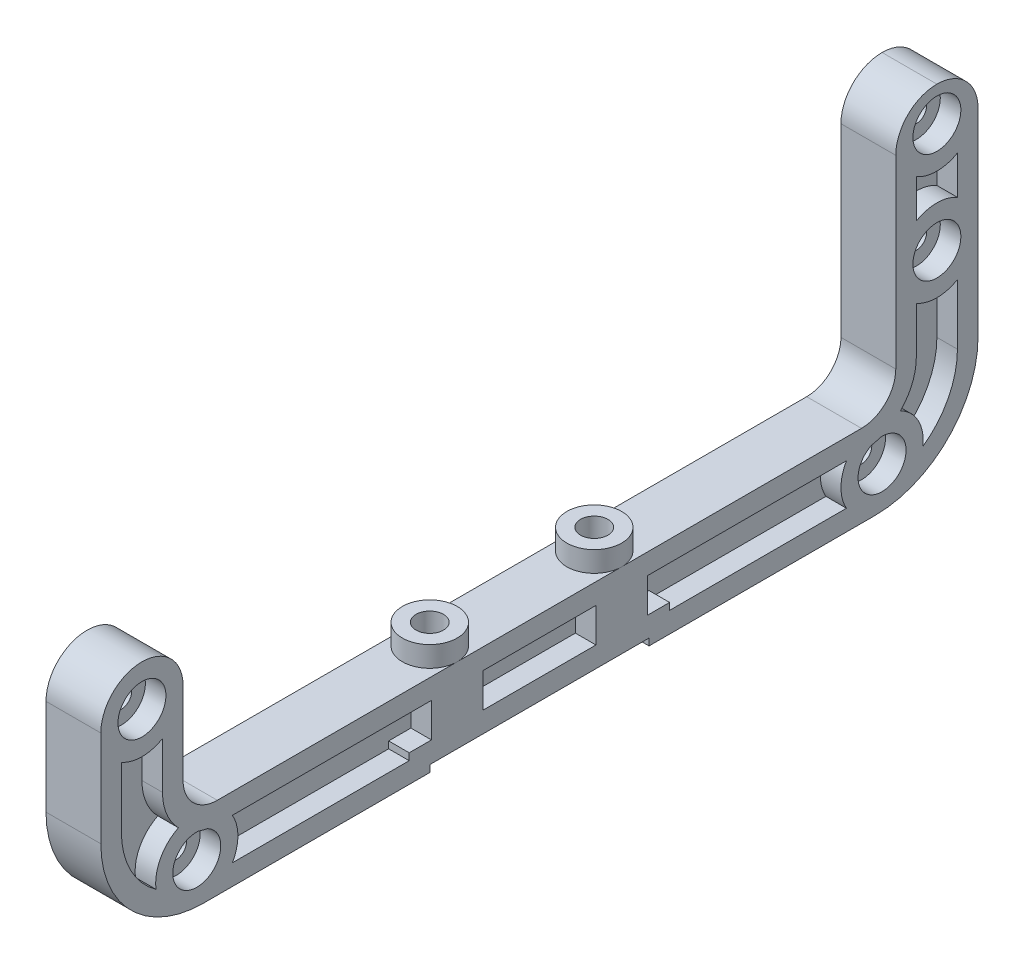
from build123d import *

# Parameters (mm, degrees)
SKETCH1_R                 = 1.5
BOSS_EXTRUDE1_DEPTH       = 8
FILLET1_R                 = 6
FILLET2_R                 = 15
FILLET3_R                 = 5
SKETCH2_R                 = 2
CUT_EXTRUDE1_DEPTH        = 97.187317251
BOSS_EXTRUDE2_START       = 3
SKETCH3_R                 = 4
SKETCH3_R_2               = 2
BOSS_EXTRUDE2_DEPTH       = 3
CUT_EXTRUDE2_START        = -3
SKETCH4_W                 = 14.5
SKETCH4_H                 = 5
SKETCH4_R                 = 1.5
SKETCH4_R_2               = 3.5
CUT_EXTRUDE2_DEPTH        = 3
MIRROR3_START             = -3
MIRROR3_COPY_1_SKETCH_W   = 14.5
MIRROR3_COPY_1_SKETCH_H   = 5
MIRROR3_COPY_1_SKETCH_R   = 1.5
MIRROR3_COPY_1_SKETCH_R_2 = 3.5
MIRROR3_COPY_1_DEPTH      = 3
MIRROR3_COPY_2_SKETCH_W   = 14.5
MIRROR3_COPY_2_SKETCH_H   = 5
MIRROR3_COPY_2_SKETCH_R   = 1.5
MIRROR3_COPY_2_SKETCH_R_2 = 3.5
MIRROR3_COPY_2_DEPTH      = 3
FILLET4_R                 = 5
FILLET5_R                 = 15
FILLET6_R                 = 6
CUT_EXTRUDE3_DEPTH        = 99.711701434


with BuildPart() as part:
    # Sketch1 → Boss-Extrude1 (new body)
    with BuildSketch(Plane(origin=(0, 0, 0), x_dir=(0, 0, -1), z_dir=(1, 0, 0))):
        Polygon((-88, -6), (-40, -6), (-40, -5), (-8, -5), (-8, -6), (40, -6), (40, 44), (28, 44), (28, 6), (-76, 6), (-76, 44), (-88, 44), align=None)
        with Locations((-74, 0)):
            Circle(SKETCH1_R, mode=Mode.SUBTRACT)
        with Locations((26, 0)):
            Circle(SKETCH1_R, mode=Mode.SUBTRACT)
        with Locations((-82, 39)):
            Circle(SKETCH1_R, mode=Mode.SUBTRACT)
        with Locations((-82, 23)):
            Circle(SKETCH1_R, mode=Mode.SUBTRACT)
        with Locations((34, 39)):
            Circle(SKETCH1_R, mode=Mode.SUBTRACT)
        with Locations((34, 23)):
            Circle(SKETCH1_R, mode=Mode.SUBTRACT)
    extrude(amount=BOSS_EXTRUDE1_DEPTH)

    # Fillet1
    fillet1_edges = [part.edges().sort_by_distance(p)[0] for p in [
        (4, 44, -28),
        (4, 44, -40),
    ]]
    fillet(fillet1_edges, radius=FILLET1_R - 0.0001)  # a hair under: the kernel refuses the full size

    # Fillet2
    fillet2_edges = [part.edges().sort_by_distance(p)[0] for p in [
        (4, -6, -40),
    ]]
    fillet(fillet2_edges, radius=FILLET2_R)

    # Fillet3
    fillet3_edges = [part.edges().sort_by_distance(p)[0] for p in [
        (4, 6, -28),
    ]]
    fillet(fillet3_edges, radius=FILLET3_R)

    # Sketch2 → Cut-Extrude1 (cut, through all)
    with BuildSketch(Plane(origin=(0, 6, 0), x_dir=(1, 0, 0), z_dir=(0, 1, 0))):
        with Locations(Location((4, -36, 0), (0, 0, 270))):
            Circle(SKETCH2_R)
        with Locations(Location((4, -12, 0), (0, 0, 270))):
            Circle(SKETCH2_R)
    extrude(amount=-CUT_EXTRUDE1_DEPTH, mode=Mode.SUBTRACT)

    # Sketch3 → Boss-Extrude2 (add)
    # profile 1 of 2: a face of its own
    with BuildSketch(Plane(origin=(0, 6, 0), x_dir=(1, 0, 0), z_dir=(0, 1, 0)).offset(BOSS_EXTRUDE2_START)):
        with Locations(Location((4, -12, 0), (0, 0, 180))):
            Circle(SKETCH3_R)
        with Locations(Location((4, -12, 0), (0, 0, 270))):
            Circle(SKETCH3_R_2, mode=Mode.SUBTRACT)
    # profile 2 of 2: a face of its own
    with BuildSketch(Plane(origin=(0, 6, 0), x_dir=(1, 0, 0), z_dir=(0, 1, 0)).offset(BOSS_EXTRUDE2_START)):
        with Locations(Location((4, -36, 0), (0, 0, 180))):
            Circle(SKETCH3_R)
        with Locations(Location((4, -36, 0), (0, 0, 270))):
            Circle(SKETCH3_R_2, mode=Mode.SUBTRACT)
    extrude(amount=-BOSS_EXTRUDE2_DEPTH)

    # Sketch4 → Cut-Extrude2 (cut)
    # profile 1 of 7: a face of its own
    with BuildSketch(Plane(origin=(8, 0, 0), x_dir=(0, 0, -1), z_dir=(1, 0, 0)).offset(CUT_EXTRUDE2_START)):
        with Locations((-23, 0.5)):
            Rectangle(SKETCH4_W, SKETCH4_H)
    # profile 2 of 7: a face of its own
    with BuildSketch(Plane(origin=(8, 0, 0), x_dir=(0, 0, -1), z_dir=(1, 0, 0)).offset(CUT_EXTRUDE2_START)):
        with BuildLine():
            Line((-8.25, 3), (-8.25, -2))
            Line((-8.25, -2), (-5, -2))
            Line((-5, -2), (-5, -3))
            Line((-5, -3), (20.803847577, -3))
            ThreePointArc((20.803847577, -3), (20, 0), (20.803847577, 3))
            Line((20.803847577, 3), (-8.25, 3))
        make_face()
    # profile 3 of 7: a face of its own
    with BuildSketch(Plane(origin=(8, 0, 0), x_dir=(0, 0, -1), z_dir=(1, 0, 0)).offset(CUT_EXTRUDE2_START)):
        with BuildLine():
            ThreePointArc((31, 11), (30.397622439, 7.954481613), (28.681204439, 5.367601211))
            ThreePointArc((28.681204439, 5.367601211), (31.29881697, 2.814700468), (31.948625864, -0.783486015))
            ThreePointArc((31.948625864, -0.783486015), (35.662633595, 3.494707563), (37, 9))
            Line((37, 9), (37, 17.803847577))
            ThreePointArc((37, 17.803847577), (34, 17), (31, 17.803847577))
            Line((31, 17.803847577), (31, 11))
        make_face()
    # profile 4 of 7: a face of its own
    with BuildSketch(Plane(origin=(8, 0, 0), x_dir=(0, 0, -1), z_dir=(1, 0, 0)).offset(CUT_EXTRUDE2_START)):
        with BuildLine():
            ThreePointArc((25.761948832, 3.491895136), (25.104939246, 3.28188943), (24.432281937, 3.12925871))
            ThreePointArc((24.432281937, 3.12925871), (26.92091092, -3.376673374), (25.761948832, 3.491895136))
        make_face()
        with Locations((26, 0)):
            Circle(SKETCH4_R, mode=Mode.SUBTRACT)
    # profile 5 of 7: a face of its own
    with BuildSketch(Plane(origin=(8, 0, 0), x_dir=(0, 0, -1), z_dir=(1, 0, 0)).offset(CUT_EXTRUDE2_START)):
        with Locations((34, 23)):
            Circle(SKETCH4_R_2)
        with Locations((34, 23)):
            Circle(SKETCH4_R, mode=Mode.SUBTRACT)
    # profile 6 of 7: a face of its own
    with BuildSketch(Plane(origin=(8, 0, 0), x_dir=(0, 0, -1), z_dir=(1, 0, 0)).offset(CUT_EXTRUDE2_START)):
        with BuildLine():
            Line((31, 33.803847577), (31, 28.196152423))
            ThreePointArc((31, 28.196152423), (34, 29), (37, 28.196152423))
            Line((37, 28.196152423), (37, 33.803847577))
            ThreePointArc((37, 33.803847577), (34, 33), (31, 33.803847577))
        make_face()
    # profile 7 of 7: a face of its own
    with BuildSketch(Plane(origin=(8, 0, 0), x_dir=(0, 0, -1), z_dir=(1, 0, 0)).offset(CUT_EXTRUDE2_START)):
        with Locations((34, 39)):
            Circle(SKETCH4_R_2)
        with Locations((34, 39)):
            Circle(SKETCH4_R, mode=Mode.SUBTRACT)
    cut_extrude2 = extrude(amount=CUT_EXTRUDE2_DEPTH, mode=Mode.SUBTRACT)

    # Mirror1: Cut-Extrude2 across plane
    add(cut_extrude2.mirror(Plane.ZY.offset(-4)), mode=Mode.SUBTRACT)

    # Mirror2: Cut-Extrude2 across plane
    add(cut_extrude2.mirror(Plane(origin=(0, 0, 24), x_dir=(1, 0, 0), z_dir=(0, 0, -1))), mode=Mode.SUBTRACT)

    # Mirror3 copy 1 sketch → Mirror3 copy 1 (cut)
    # profile 1 of 7: a face of its own
    with BuildSketch(Plane(origin=(0, 0, 48), x_dir=(0, 0, 1), z_dir=(-1, 0, 0)).offset(MIRROR3_START)):
        with Locations((-23, 0.5)):
            Rectangle(MIRROR3_COPY_1_SKETCH_W, MIRROR3_COPY_1_SKETCH_H)
    # profile 2 of 7: a face of its own
    with BuildSketch(Plane(origin=(0, 0, 48), x_dir=(0, 0, 1), z_dir=(-1, 0, 0)).offset(MIRROR3_START)):
        with BuildLine():
            Line((-8.25, 3), (-8.25, -2))
            Line((-8.25, -2), (-5, -2))
            Line((-5, -2), (-5, -3))
            Line((-5, -3), (20.803847577, -3))
            ThreePointArc((20.803847577, -3), (20, 0), (20.803847577, 3))
            Line((20.803847577, 3), (-8.25, 3))
        make_face()
    # profile 3 of 7: a face of its own
    with BuildSketch(Plane(origin=(0, 0, 48), x_dir=(0, 0, 1), z_dir=(-1, 0, 0)).offset(MIRROR3_START)):
        with BuildLine():
            ThreePointArc((31, 11), (30.397622439, 7.954481613), (28.681204439, 5.367601211))
            ThreePointArc((28.681204439, 5.367601211), (31.29881697, 2.814700468), (31.948625864, -0.783486015))
            ThreePointArc((31.948625864, -0.783486015), (35.662633595, 3.494707563), (37, 9))
            Line((37, 9), (37, 17.803847577))
            ThreePointArc((37, 17.803847577), (34, 17), (31, 17.803847577))
            Line((31, 17.803847577), (31, 11))
        make_face()
    # profile 4 of 7: a face of its own
    with BuildSketch(Plane(origin=(0, 0, 48), x_dir=(0, 0, 1), z_dir=(-1, 0, 0)).offset(MIRROR3_START)):
        with BuildLine():
            ThreePointArc((25.761948832, 3.491895136), (25.104939246, 3.28188943), (24.432281937, 3.12925871))
            ThreePointArc((24.432281937, 3.12925871), (26.92091092, -3.376673374), (25.761948832, 3.491895136))
        make_face()
        with Locations((26, 0)):
            Circle(MIRROR3_COPY_1_SKETCH_R, mode=Mode.SUBTRACT)
    # profile 5 of 7: a face of its own
    with BuildSketch(Plane(origin=(0, 0, 48), x_dir=(0, 0, 1), z_dir=(-1, 0, 0)).offset(MIRROR3_START)):
        with Locations((34, 23)):
            Circle(MIRROR3_COPY_1_SKETCH_R_2)
        with Locations((34, 23)):
            Circle(MIRROR3_COPY_1_SKETCH_R, mode=Mode.SUBTRACT)
    # profile 6 of 7: a face of its own
    with BuildSketch(Plane(origin=(0, 0, 48), x_dir=(0, 0, 1), z_dir=(-1, 0, 0)).offset(MIRROR3_START)):
        with BuildLine():
            Line((31, 33.803847577), (31, 28.196152423))
            ThreePointArc((31, 28.196152423), (34, 29), (37, 28.196152423))
            Line((37, 28.196152423), (37, 33.803847577))
            ThreePointArc((37, 33.803847577), (34, 33), (31, 33.803847577))
        make_face()
    # profile 7 of 7: a face of its own
    with BuildSketch(Plane(origin=(0, 0, 48), x_dir=(0, 0, 1), z_dir=(-1, 0, 0)).offset(MIRROR3_START)):
        with Locations((34, 39)):
            Circle(MIRROR3_COPY_1_SKETCH_R_2)
        with Locations((34, 39)):
            Circle(MIRROR3_COPY_1_SKETCH_R, mode=Mode.SUBTRACT)
    extrude(amount=MIRROR3_COPY_1_DEPTH, mode=Mode.SUBTRACT)

    # Mirror3 copy 2 sketch → Mirror3 copy 2 (cut)
    # profile 1 of 7: a face of its own
    with BuildSketch(Plane(origin=(0, 0, 0), x_dir=(0, 0, -1), z_dir=(-1, 0, 0)).offset(MIRROR3_START)):
        with Locations((-23, -0.5)):
            Rectangle(MIRROR3_COPY_2_SKETCH_W, MIRROR3_COPY_2_SKETCH_H)
    # profile 2 of 7: a face of its own
    with BuildSketch(Plane(origin=(0, 0, 0), x_dir=(0, 0, -1), z_dir=(-1, 0, 0)).offset(MIRROR3_START)):
        with BuildLine():
            Line((-8.25, -3), (-8.25, 2))
            Line((-8.25, 2), (-5, 2))
            Line((-5, 2), (-5, 3))
            Line((-5, 3), (20.803847577, 3))
            ThreePointArc((20.803847577, 3), (20, 0), (20.803847577, -3))
            Line((20.803847577, -3), (-8.25, -3))
        make_face()
    # profile 3 of 7: a face of its own
    with BuildSketch(Plane(origin=(0, 0, 0), x_dir=(0, 0, -1), z_dir=(-1, 0, 0)).offset(MIRROR3_START)):
        with BuildLine():
            ThreePointArc((31, -11), (30.397622439, -7.954481613), (28.681204439, -5.367601211))
            ThreePointArc((28.681204439, -5.367601211), (31.29881697, -2.814700468), (31.948625864, 0.783486015))
            ThreePointArc((31.948625864, 0.783486015), (35.662633595, -3.494707563), (37, -9))
            Line((37, -9), (37, -17.803847577))
            ThreePointArc((37, -17.803847577), (34, -17), (31, -17.803847577))
            Line((31, -17.803847577), (31, -11))
        make_face()
    # profile 4 of 7: a face of its own
    with BuildSketch(Plane(origin=(0, 0, 0), x_dir=(0, 0, -1), z_dir=(-1, 0, 0)).offset(MIRROR3_START)):
        with BuildLine():
            ThreePointArc((25.761948832, -3.491895136), (25.104939246, -3.28188943), (24.432281937, -3.12925871))
            ThreePointArc((24.432281937, -3.12925871), (26.92091092, 3.376673374), (25.761948832, -3.491895136))
        make_face()
        with Locations((26, 0)):
            Circle(MIRROR3_COPY_2_SKETCH_R, mode=Mode.SUBTRACT)
    # profile 5 of 7: a face of its own
    with BuildSketch(Plane(origin=(0, 0, 0), x_dir=(0, 0, -1), z_dir=(-1, 0, 0)).offset(MIRROR3_START)):
        with Locations((34, -23)):
            Circle(MIRROR3_COPY_2_SKETCH_R_2)
        with Locations((34, -23)):
            Circle(MIRROR3_COPY_2_SKETCH_R, mode=Mode.SUBTRACT)
    # profile 6 of 7: a face of its own
    with BuildSketch(Plane(origin=(0, 0, 0), x_dir=(0, 0, -1), z_dir=(-1, 0, 0)).offset(MIRROR3_START)):
        with BuildLine():
            Line((31, -33.803847577), (31, -28.196152423))
            ThreePointArc((31, -28.196152423), (34, -29), (37, -28.196152423))
            Line((37, -28.196152423), (37, -33.803847577))
            ThreePointArc((37, -33.803847577), (34, -33), (31, -33.803847577))
        make_face()
    # profile 7 of 7: a face of its own
    with BuildSketch(Plane(origin=(0, 0, 0), x_dir=(0, 0, -1), z_dir=(-1, 0, 0)).offset(MIRROR3_START)):
        with Locations((34, -39)):
            Circle(MIRROR3_COPY_2_SKETCH_R_2)
        with Locations((34, -39)):
            Circle(MIRROR3_COPY_2_SKETCH_R, mode=Mode.SUBTRACT)
    extrude(amount=MIRROR3_COPY_2_DEPTH, mode=Mode.SUBTRACT)

    # Fillet4
    fillet4_edges = [part.edges().sort_by_distance(p)[0] for p in [
        (4, 6, 76),
    ]]
    fillet(fillet4_edges, radius=FILLET4_R)

    # Fillet5
    fillet5_edges = [part.edges().sort_by_distance(p)[0] for p in [
        (4, -6, 88),
    ]]
    fillet(fillet5_edges, radius=FILLET5_R)

    # Fillet6
    fillet6_edges = [part.edges().sort_by_distance(p)[0] for p in [
        (4, 44, 76),
        (4, 44, 88),
    ]]
    fillet(fillet6_edges, radius=FILLET6_R - 0.0001)  # a hair under: the kernel refuses the full size

    # Sketch5 → Cut-Extrude3 (cut, through all)
    with BuildSketch(Plane.ZY):
        with BuildLine():
            ThreePointArc((82, 44), (77.757359313, 42.242640687), (76, 38))
            Line((76, 38), (76, 23))
            ThreePointArc((76, 23), (82, 29), (88, 23))
            Line((88, 23), (88, 38))
            ThreePointArc((88, 38), (86.242640687, 42.242640687), (82, 44))
        make_face()
    extrude(amount=-CUT_EXTRUDE3_DEPTH, mode=Mode.SUBTRACT)


with BuildPart() as cut_extrude3_kept_piece:
    # of the separate pieces the step leaves, the one the design keeps (cut_extrude3_pieces_kept)
    add(part.part.solids().sort_by_distance((0, 23, 88))[0])


solid = cut_extrude3_kept_piece.part
